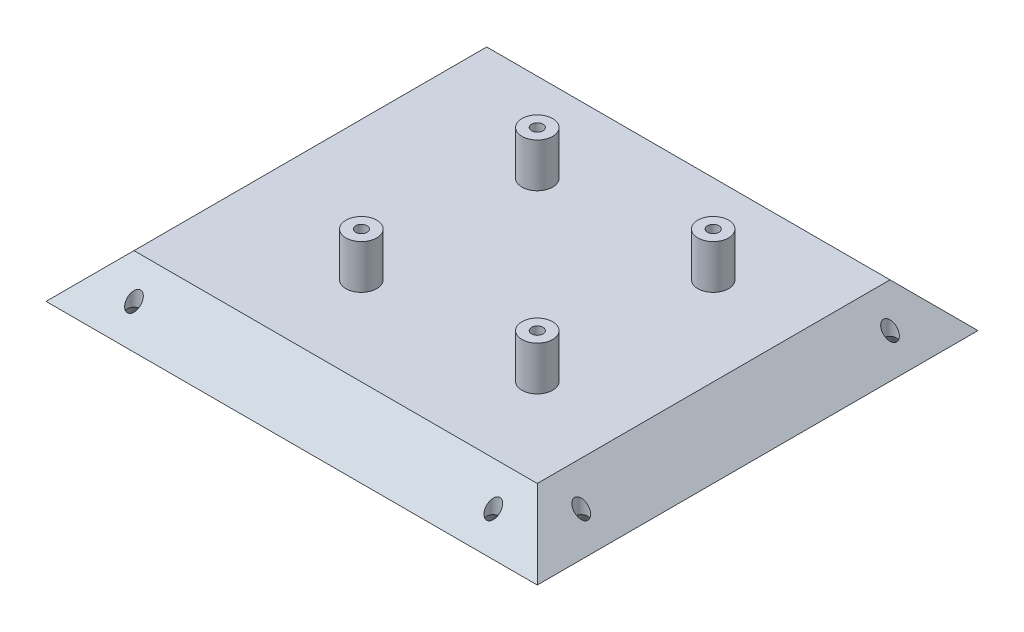
from build123d import *

# Parameters (mm, degrees)
SKETCH3_R           = 1.5
CUT_EXTRUDE1_DEPTH  = 151.389261732
SKETCH4_R           = 3.5
SKETCH4_R_2         = 1.3
BOSS_EXTRUDE1_DEPTH = 10
SKETCH5_R           = 3.3
SKETCH6_R           = 1.5


# Read off the part's stored shape, not the designer's step: Mirror2, Mirror3
with BuildPart() as part:
    # Sketch1 → Loft1 section 0
    with BuildSketch(Plane(origin=(0, 0, 0), x_dir=(1, 0, 0), z_dir=(0, 1, 0))):
        with BuildLine():
            Line((0, 0), (111.7, 0))
            Line((111.7, 0), (111.7, -100.2))
            Line((111.7, -100.2), (0, -100.2))
            Line((0, -100.2), (0, 0))
        make_face()
    # Sketch2 → Loft1 section 1
    with BuildSketch(Plane(origin=(0, 10, 0), x_dir=(1, 0, 0), z_dir=(0, 1, 0))):
        with BuildLine():
            Line((10, -10), (10, -90.2))
            Line((10, -90.2), (101.7, -90.2))
            Line((101.7, -90.2), (101.7, -10))
            Line((101.7, -10), (10, -10))
        make_face()
    loft()

    # Sketch3 → Cut-Extrude1 (cut, through all)
    with BuildSketch(Plane.XZ):
        with Locations(Location((5, 15, 0), (0, 0, 270))):
            Circle(SKETCH3_R)
        with Locations(Location((5, 85.2, 0), (0, 0, 180))):
            Circle(SKETCH3_R)
        with Locations(Location((106.7, 85.2, 0), (0, 0, 270))):
            Circle(SKETCH3_R)
        with Locations((106.7, 15)):
            Circle(SKETCH3_R)
        with Locations(Location((15, 5, 0), (0, 0, 270))):
            Circle(SKETCH3_R)
        with Locations(Location((15, 95.2, 0), (0, 0, 270))):
            Circle(SKETCH3_R)
        with Locations(Location((96.7, 95.2, 0), (0, 0, 90))):
            Circle(SKETCH3_R)
        with Locations(Location((96.7, 5, 0), (0, 0, 270))):
            Circle(SKETCH3_R)
    extrude(amount=-CUT_EXTRUDE1_DEPTH, mode=Mode.SUBTRACT)

    # Sketch4 → Boss-Extrude1 (add)
    # profile 1 of 4: a face of its own
    with BuildSketch(Plane(origin=(0, 10, 0), x_dir=(1, 0, 0), z_dir=(0, 1, 0))):
        with Locations(Location((81.6, -70.1, 0), (0, 0, 270))):
            Circle(SKETCH4_R)
        with Locations(Location((81.6, -70.1, 0), (0, 0, 270))):
            Circle(SKETCH4_R_2, mode=Mode.SUBTRACT)
    # profile 2 of 4: a face of its own
    with BuildSketch(Plane(origin=(0, 10, 0), x_dir=(1, 0, 0), z_dir=(0, 1, 0))):
        with Locations(Location((81.6, -30.1, 0), (0, 0, 90))):
            Circle(SKETCH4_R)
        with Locations(Location((81.6, -30.1, 0), (0, 0, 90))):
            Circle(SKETCH4_R_2, mode=Mode.SUBTRACT)
    # profile 3 of 4: a face of its own
    with BuildSketch(Plane(origin=(0, 10, 0), x_dir=(1, 0, 0), z_dir=(0, 1, 0))):
        with Locations(Location((41.6, -70.1, 0), (0, 0, 90))):
            Circle(SKETCH4_R)
        with Locations(Location((41.6, -70.1, 0), (0, 0, 90))):
            Circle(SKETCH4_R_2, mode=Mode.SUBTRACT)
    # profile 4 of 4: a face of its own
    with BuildSketch(Plane(origin=(0, 10, 0), x_dir=(1, 0, 0), z_dir=(0, 1, 0))):
        with Locations(Location((41.6, -30.1, 0), (0, 0, 270))):
            Circle(SKETCH4_R)
        with Locations(Location((41.6, -30.1, 0), (0, 0, 270))):
            Circle(SKETCH4_R_2, mode=Mode.SUBTRACT)
    extrude(amount=BOSS_EXTRUDE1_DEPTH)

    # Sketch5 → Cut-Loft1 section 0
    with BuildSketch(Plane.XZ):
        with Locations((106.7, 85.2)):
            Circle(SKETCH5_R)
    # Sketch6 → Cut-Loft1 section 1
    with BuildSketch(Plane(origin=(0, 2.8, 0), x_dir=(-1, 0, 0), z_dir=(0, -1, 0))):
        with Locations((-106.7, -85.2)):
            Circle(SKETCH6_R)
    cut_loft1 = loft(mode=Mode.SUBTRACT)

    # Mirror1: Cut-Loft1 across plane
    add(cut_loft1.mirror(Plane(origin=(5.75, 0, -5.75), x_dir=(0.7071067811865476, 0, 0.7071067811865476), z_dir=(0.7071067811865477, 0, -0.7071067811865475))), mode=Mode.SUBTRACT)

    # Mirror2 outline → Mirror2 (revolve, cut)
    with BuildSketch(Plane(origin=(106.7, 0, 15), x_dir=(1, 0, 0), z_dir=(0, 0, 1))):
        Polygon((3.3, 0), (1.5, 2.8), (1.5, 0), align=None)
    revolve(axis=Axis((106.7, 0, 15), (0, 1, 0)), mode=Mode.SUBTRACT)

    # Mirror2 2 outline → Mirror2 2 (revolve, cut)
    with BuildSketch(Plane(origin=(96.7, 0, 5), x_dir=(1, 0, 0), z_dir=(0, 0, 1))):
        Polygon((3.3, 0), (1.5, 2.8), (1.5, 0), align=None)
    revolve(axis=Axis((96.7, 0, 5), (0, 1, 0)), mode=Mode.SUBTRACT)

    # Mirror3 outline → Mirror3 (revolve, cut)
    with BuildSketch(Plane(origin=(5, 0, 85.2), x_dir=(1, 0, 0), z_dir=(0, 0, 1))):
        Polygon((3.3, 0), (1.5, 2.8), (1.5, 0), align=None)
    revolve(axis=Axis((5, 0, 85.2), (0, 1, 0)), mode=Mode.SUBTRACT)

    # Mirror3 2 outline → Mirror3 2 (revolve, cut)
    with BuildSketch(Plane(origin=(15, 0, 95.2), x_dir=(1, 0, 0), z_dir=(0, 0, 1))):
        Polygon((3.3, 0), (1.5, 2.8), (1.5, 0), align=None)
    revolve(axis=Axis((15, 0, 95.2), (0, 1, 0)), mode=Mode.SUBTRACT)

    # Mirror3 3 outline → Mirror3 3 (revolve, cut)
    with BuildSketch(Plane(origin=(5, 0, 15), x_dir=(1, 0, 0), z_dir=(0, 0, 1))):
        Polygon((3.3, 0), (1.5, 2.8), (1.5, 0), align=None)
    revolve(axis=Axis((5, 0, 15), (0, 1, 0)), mode=Mode.SUBTRACT)

    # Mirror3 4 outline → Mirror3 4 (revolve, cut)
    with BuildSketch(Plane(origin=(15, 0, 5), x_dir=(1, 0, 0), z_dir=(0, 0, 1))):
        Polygon((3.3, 0), (1.5, 2.8), (1.5, 0), align=None)
    revolve(axis=Axis((15, 0, 5), (0, 1, 0)), mode=Mode.SUBTRACT)


solid = part.part
